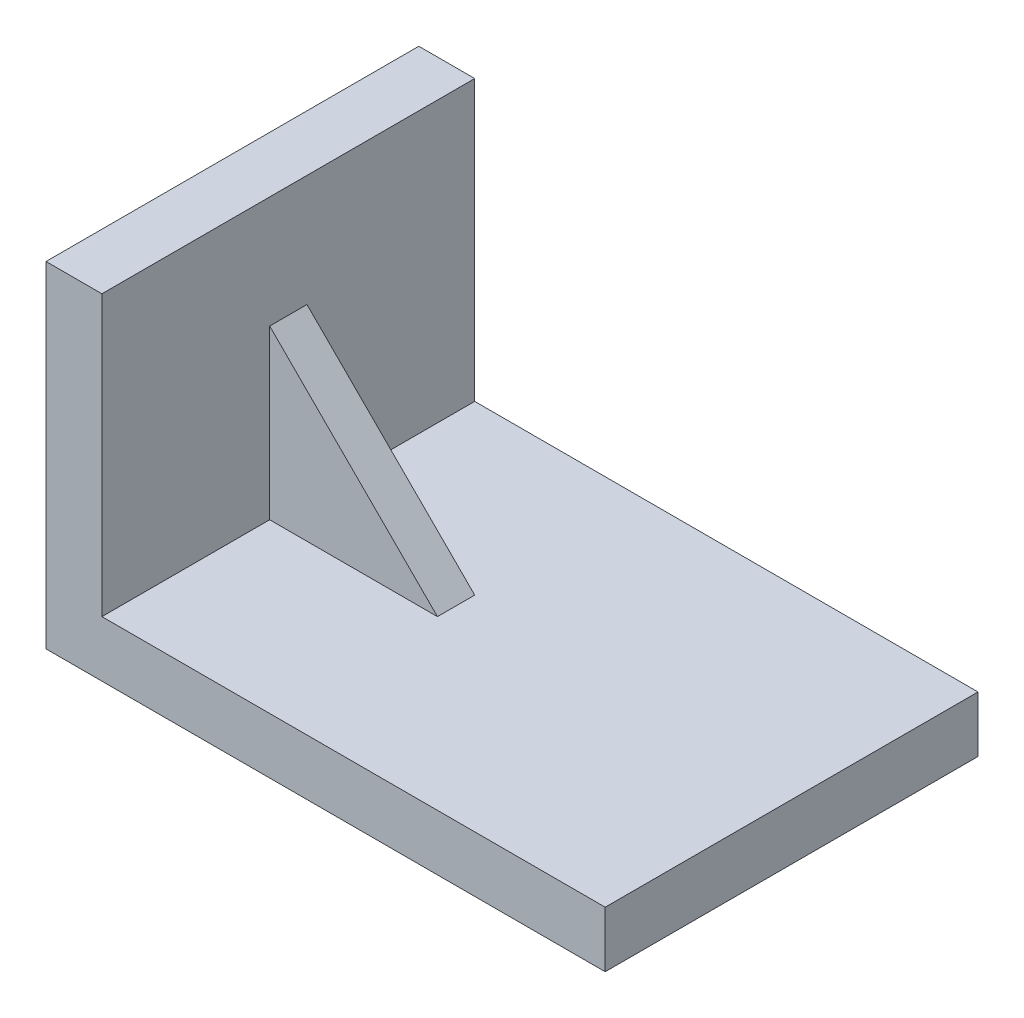
from build123d import *

# Parameters (mm, degrees)
SKETCH_1_W      = 60
SKETCH_1_H      = 40
EXTRUDE_1_DEPTH = 6
SKETCH_2_W      = 40
SKETCH_2_H      = 36
EXTRUDE_2_DEPTH = 6
EXTRUDE_START   = -2
EXTRUDE_3_DEPTH = 4


# Read off the part's stored shape, not the designer's step: 凸台-拉伸3
with BuildPart() as part:
    # 草图1 → 凸台-拉伸1 (new body)
    with BuildSketch(Plane(origin=(0, 0, 0), x_dir=(1, 0, 0), z_dir=(0, 1, 0))):
        with Locations((30, 0)):
            Rectangle(SKETCH_1_W, SKETCH_1_H)
    extrude(amount=EXTRUDE_1_DEPTH)

    # 草图2 → 凸台-拉伸2 (add)
    with BuildSketch(Plane(origin=(0, 0, 0), x_dir=(0, 0, -1), z_dir=(1, 0, 0))):
        with Locations((0, 18)):
            Rectangle(SKETCH_2_W, SKETCH_2_H)
    extrude(amount=EXTRUDE_2_DEPTH)

    # 凸台-拉伸3 outline → 凸台-拉伸3 (add)
    with BuildSketch(Plane.XY.offset(EXTRUDE_START)):
        Polygon((24, 6), (6, 24), (6, 6), align=None)
    extrude(amount=EXTRUDE_3_DEPTH)


solid = part.part
